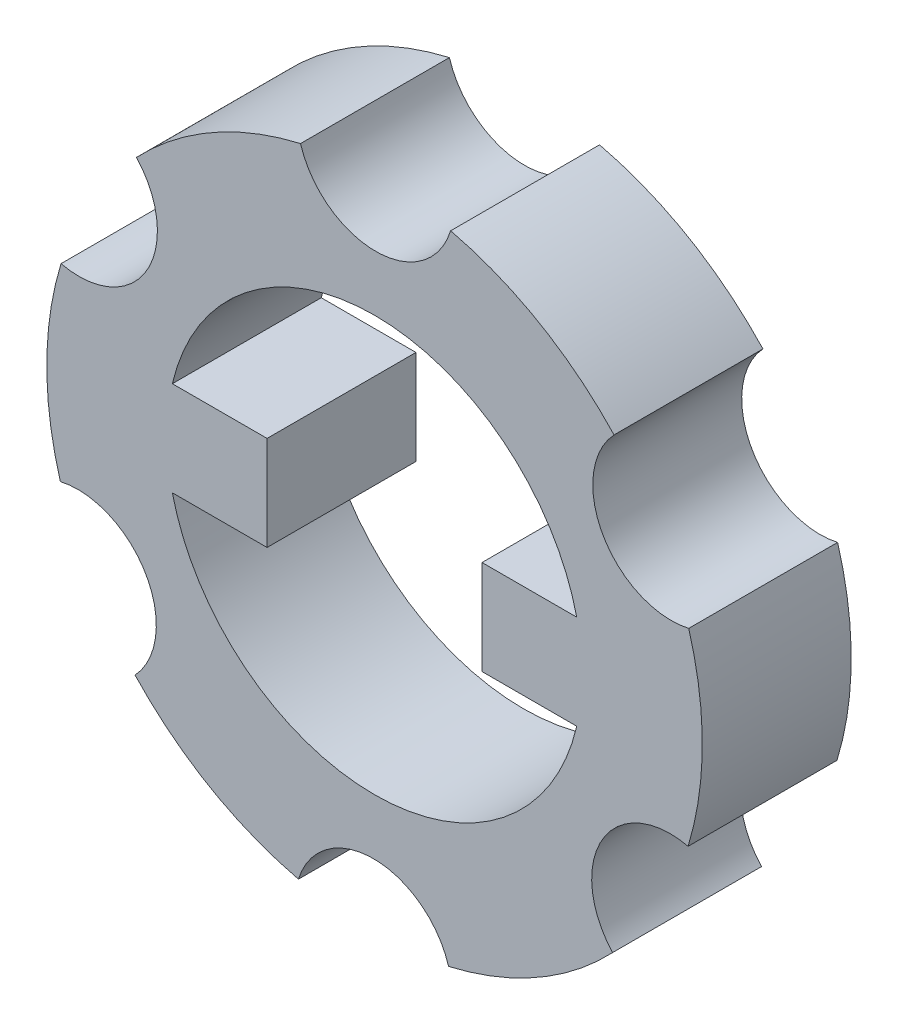
from build123d import *

# Parameters (mm, degrees)
SKETCH3_R               = 21
BOSS_EXTRUDE3_DEPTH     = 32
CUT_EXTRUDE1_START      = -30
SKETCH4_R               = 21
SKETCH4_R_2             = 19.31273959
CUT_EXTRUDE1_DEPTH      = 28
SKETCH8_R               = 6.075
SKETCH8_R_2             = 2.409749928
CUT_EXTRUDE2_DEPTH      = 44.657759906
FILLET1_R               = 1
FILLET3_R               = 5
BOSS_EXTRUDE4_START     = -17
SKETCH11_R              = 8
BOSS_EXTRUDE4_DEPTH     = 15
SKETCH12_W              = 6.25
SKETCH12_H              = 3.5
BOSS_EXTRUDE5_DEPTH     = 17
SKETCH15_OUTSIDE_W      = 57.494
SKETCH15_OUTSIDE_H      = 57.494
SKETCH15_OUTSIDE_R      = 21
CUT_EXTRUDE3_DEPTH      = 17
SKETCH16_R              = 25.999161841
SKETCH16_R_2            = 10.063122469
CUT_EXTRUDE4_DEPTH      = 44.657759954
CUT_EXTRUDE5_DEPTH      = 35.948058737
CUT_EXTRUDE5_DEPTH_BACK = 35.948058737
SKETCH17_W              = 34.125667019
SKETCH17_H              = 28.204609122


with BuildPart() as part:
    # Sketch3 → Boss-Extrude3 (new body)
    with BuildSketch(Plane.XY):
        Circle(SKETCH3_R)
    extrude(amount=BOSS_EXTRUDE3_DEPTH)

    # Sketch4 → Cut-Extrude1 (cut)
    with BuildSketch(Plane.XY.offset(32).offset(CUT_EXTRUDE1_START)):
        Circle(SKETCH4_R)
        Circle(SKETCH4_R_2, mode=Mode.SUBTRACT)
    extrude(amount=CUT_EXTRUDE1_DEPTH, mode=Mode.SUBTRACT)

    # Cut-Sweep1: sweep along a curve in space
    with BuildLine() as cut_sweep1_path:
        ThreePointArc((19.31273959, 0, 2), (13.656169127, 13.656169127, 2), (0, 19.31273959, 2))
        ThreePointArc((0, 19.31273959, 2), (-13.656169127, 13.656169127, 2), (-19.31273959, 0, 2))
        ThreePointArc((-19.31273959, 0, 2), (-13.656169127, -13.656169127, 2), (0, -19.31273959, 2))
        ThreePointArc((0, -19.31273959, 2), (13.656169127, -13.656169127, 2), (19.31273959, 0, 2))
    # Sketch7 → Cut-Sweep1 (sweep, cut)
    with BuildSketch(Plane(origin=(0, 0, 0), x_dir=(1, 0, 0), z_dir=(0, 1, 0))):
        with BuildLine():
            Line((-19.31273959, -2), (-19.31273959, -30))
            ThreePointArc((-19.31273959, -30), (-17.146485403, -16), (-19.31273959, -2))
        make_face()
    sweep(path=cut_sweep1_path.line, mode=Mode.SUBTRACT)

    # Sketch8 → Cut-Extrude2 (cut, through all)
    with BuildSketch(Plane(origin=(0, 0, 0), x_dir=(-1, 0, 0), z_dir=(0, 0, -1))):
        Circle(SKETCH8_R)
        with Locations((9.076330186, 5.279334971)):
            Circle(SKETCH8_R_2)
        with Locations((-0.033873107, 10.5)):
            Circle(SKETCH8_R_2)
        with Locations((9.110203293, -5.220665029)):
            Circle(SKETCH8_R_2)
        with Locations((0.033873107, -10.5)):
            Circle(SKETCH8_R_2)
        with Locations((-9.076330186, -5.279334971)):
            Circle(SKETCH8_R_2)
        with Locations((-9.110203293, 5.220665029)):
            Circle(SKETCH8_R_2)
    extrude(amount=-CUT_EXTRUDE2_DEPTH, mode=Mode.SUBTRACT)

    # Sketch10 → Cut-Revolve1 (revolve, cut)
    with BuildSketch(Plane(origin=(0, 0, 0), x_dir=(1, 0, 0), z_dir=(0, 1, 0))):
        Polygon((-6.075, 0), (-15.24176478, -2.795793959), (-19.075, 0), align=None)
    revolve(axis=Axis((0, 0, 2), (0, 0, 1)), mode=Mode.SUBTRACT)

    # Fillet1
    fillet1_edges = [part.edges().sort_by_distance(p)[0] for p in [
        (-21, 0, 2),
        (-21, 0, 30),
    ]]
    fillet(fillet1_edges, radius=FILLET1_R)

    # Fillet3
    # the kernel refuses this fillet: 5 mm, written as the material it adds along each edge
    with BuildSketch(Plane(origin=(0, 0, 2.795793959), x_dir=(-1, 0, 0), z_dir=(0, 1, 0))) as fillet3_piece_1_section:
        with BuildLine():
            CenterArc((15.24176478 - FILLET3_R * 0.185863598659, -FILLET3_R * 1.10216314652), FILLET3_R, 53.894625959, 53.066683648)
            Line((15.24176478 - FILLET3_R * 0.47758946832, -FILLET3_R * 0.145661177375), (15.24176478, 0))
            Line((15.24176478, 0), (15.24176478 + FILLET3_R * 0.403408541274, -FILLET3_R * 0.294228529669))
        make_face()
    fillet3_piece_1 = revolve(axis=Axis((0, 0, 2.795793959), (0, 0, 1)), mode=Mode.PRIVATE)
    fillet3_piece_1 = fillet3_piece_1 - Plane(origin=(-9.110203293, -5.220665029, 2.265856679), x_dir=(-1, 0, 0), z_dir=(0, 0, -1)) * Cylinder(2.409749928, 70, mode=Mode.PRIVATE)
    fillet3_piece_1 = fillet3_piece_1 - Plane(origin=(-0.033873107, -10.5, 2.265856679), x_dir=(-1, 0, 0), z_dir=(0, 0, -1)) * Cylinder(2.409749928, 70, mode=Mode.PRIVATE)
    fillet3_piece_1 = fillet3_piece_1 - Plane(origin=(9.076330186, -5.279334971, 2.265856679), x_dir=(-1, 0, 0), z_dir=(0, 0, -1)) * Cylinder(2.409749928, 70, mode=Mode.PRIVATE)
    fillet3_piece_1 = fillet3_piece_1 - Plane(origin=(9.110203293, 5.220665029, 2.265856679), x_dir=(-1, 0, 0), z_dir=(0, 0, -1)) * Cylinder(2.409749928, 70, mode=Mode.PRIVATE)
    fillet3_piece_1 = fillet3_piece_1 - Plane(origin=(-9.076330186, 5.279334971, 2.265856679), x_dir=(-1, 0, 0), z_dir=(0, 0, -1)) * Cylinder(2.409749928, 70, mode=Mode.PRIVATE)
    fillet3_piece_1 = fillet3_piece_1 - Plane(origin=(0.033873107, 10.5, 2.265856679), x_dir=(-1, 0, 0), z_dir=(0, 0, -1)) * Cylinder(2.409749928, 70, mode=Mode.PRIVATE)
    add(fillet3_piece_1)

    # Sketch11 → Boss-Extrude4 (add)
    with BuildSketch(Plane.XY.offset(32).offset(BOSS_EXTRUDE4_START)):
        Circle(SKETCH11_R)
    extrude(amount=-BOSS_EXTRUDE4_DEPTH)

    # Sketch12 → Boss-Extrude5 (add)
    with BuildSketch(Plane.XY.offset(32)):
        with Locations((-6.125, 0)):
            Rectangle(SKETCH12_W, SKETCH12_H)
        with Locations((6.125, 0)):
            Rectangle(SKETCH12_W, SKETCH12_H)
    extrude(amount=-BOSS_EXTRUDE5_DEPTH)

    # Sketch15 outside → Cut-Extrude3 (cut)
    # profile 1 of 2: a face of its own
    with BuildSketch(Plane.XY.offset(32)):
        Rectangle(SKETCH15_OUTSIDE_W, SKETCH15_OUTSIDE_H)
        Circle(SKETCH15_OUTSIDE_R, mode=Mode.SUBTRACT)
    # profile 2 of 2: a face of its own
    with BuildSketch(Plane.XY.offset(32)):
        with BuildLine():
            Line((-6.207908263, 1.45), (-3.3, 1.45))
            Line((-3.3, 1.45), (-3.3, -1.45))
            Line((-3.3, -1.45), (-6.207908263, -1.45))
            ThreePointArc((-6.207908263, -1.45), (0, -6.375), (6.207908263, -1.45))
            Line((6.207908263, -1.45), (3.3, -1.45))
            Line((3.3, -1.45), (3.3, 1.45))
            Line((3.3, 1.45), (6.207908263, 1.45))
            ThreePointArc((6.207908263, 1.45), (0, 6.375), (-6.207908263, 1.45))
        make_face()
    extrude(amount=-CUT_EXTRUDE3_DEPTH, mode=Mode.SUBTRACT)

    # Sketch16 → Cut-Extrude4 (cut, through all)
    with BuildSketch(Plane.XY.offset(32)):
        Circle(SKETCH16_R)
        Circle(SKETCH16_R_2, mode=Mode.SUBTRACT)
    extrude(amount=-CUT_EXTRUDE4_DEPTH, mode=Mode.SUBTRACT)

    # Sketch17 → Cut-Extrude5 (cut, two sides: drawn at the far end of the back side and taken through both)
    with BuildSketch(Plane(origin=(0, 0, 0), x_dir=(1, 0, 0), z_dir=(0, 1, 0)).offset(-CUT_EXTRUDE5_DEPTH_BACK)):
        with Locations((1.878185032, -13.325973853)):
            Rectangle(SKETCH17_W, SKETCH17_H)
    extrude(amount=CUT_EXTRUDE5_DEPTH + CUT_EXTRUDE5_DEPTH_BACK, mode=Mode.SUBTRACT)


solid = part.part
